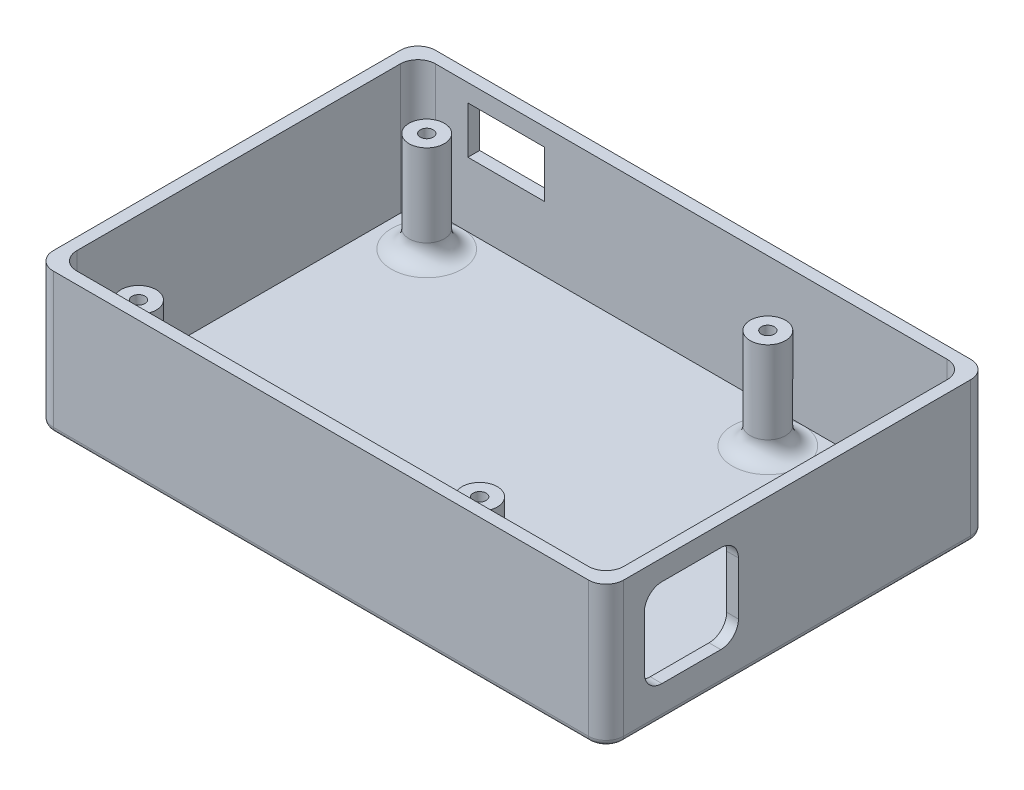
from build123d import *

# Parameters (mm, degrees)
SKETCH1_W           = 97
SKETCH1_H           = 65
BOSS_EXTRUDE1_DEPTH = 2
SKETCH3_W           = 97
SKETCH3_H           = 65
SKETCH3_W_2         = 93
SKETCH3_H_2         = 61
BOSS_EXTRUDE2_DEPTH = 22
SKETCH4_R           = 3
BOSS_EXTRUDE3_DEPTH = 17
SKETCH5_R           = 1.1
CUT_EXTRUDE1_DEPTH  = 10
FILLET1_R           = 3
FILLET2_R           = 3
CUT_EXTRUDE2_REACH  = 107.077
SKETCH6_W           = 16
SKETCH6_H           = 15
FILLET3_R           = 3
CUT_EXTRUDE3_REACH  = 86.577
SKETCH7_W           = 13
SKETCH7_H           = 8
FILLET4_R           = 1


with BuildPart() as part:
    # Sketch1 → Boss-Extrude1 (new body)
    with BuildSketch(Plane(origin=(0, 0, 0), x_dir=(1, 0, 0), z_dir=(0, 1, 0))):
        Rectangle(SKETCH1_W, SKETCH1_H)
    extrude(amount=BOSS_EXTRUDE1_DEPTH)

    # Sketch3 → Boss-Extrude2 (add)
    with BuildSketch(Plane(origin=(0, 2, 0), x_dir=(1, 0, 0), z_dir=(0, 1, 0))):
        Rectangle(SKETCH3_W, SKETCH3_H)
        Rectangle(SKETCH3_W_2, SKETCH3_H_2, mode=Mode.SUBTRACT)
    extrude(amount=BOSS_EXTRUDE2_DEPTH)

    # Sketch4 → Boss-Extrude3 (add)
    with BuildSketch(Plane(origin=(0, 2, 0), x_dir=(1, 0, 0), z_dir=(0, 1, 0))):
        with Locations(Location((-39, 24.5, 0), (0, 0, 270))):
            Circle(SKETCH4_R)
        with Locations(Location((-39, -24.5, 0), (0, 0, 90))):
            Circle(SKETCH4_R)
        with Locations(Location((19, -24.5, 0), (0, 0, 270))):
            Circle(SKETCH4_R)
        with Locations(Location((19, 24.5, 0), (0, 0, 90))):
            Circle(SKETCH4_R)
    extrude(amount=BOSS_EXTRUDE3_DEPTH)

    # Sketch5 → Cut-Extrude1 (cut)
    with BuildSketch(Plane(origin=(0, 19, 0), x_dir=(1, 0, 0), z_dir=(0, 1, 0))):
        with Locations(Location((-39, 24.5, 0), (0, 0, 270))):
            Circle(SKETCH5_R)
        with Locations(Location((19, 24.5, 0), (0, 0, 270))):
            Circle(SKETCH5_R)
        with Locations(Location((19, -24.5, 0), (0, 0, 270))):
            Circle(SKETCH5_R)
        with Locations(Location((-39, -24.5, 0), (0, 0, 270))):
            Circle(SKETCH5_R)
    extrude(amount=-CUT_EXTRUDE1_DEPTH, mode=Mode.SUBTRACT)

    # Fillet1
    fillet1_edges = [part.edges().sort_by_distance(p)[0] for p in [
        (-39, 2, -27.5),
        (-39, 2, 27.5),
        (19, 2, 21.5),
        (19, 2, -21.5),
    ]]
    fillet(fillet1_edges, radius=FILLET1_R - 0.0001)  # a hair under: the kernel refuses the full size

    # Fillet2
    fillet2_edges = [part.edges().sort_by_distance(p)[0] for p in [
        (46.5, 13, -30.5),
        (-46.5, 13, -30.5),
        (-46.5, 13, 30.5),
        (46.5, 13, 30.5),
        (48.5, 12, 32.5),
        (-48.5, 12, 32.5),
        (-48.5, 12, -32.5),
        (48.5, 12, -32.5),
    ]]
    fillet(fillet2_edges, radius=FILLET2_R)

    # Sketch6 → Cut-Extrude2 (cut, up to next)
    with BuildSketch(Plane(origin=(48.5, 0, 0), x_dir=(0, 0, -1), z_dir=(1, 0, 0)), mode=Mode.PRIVATE) as cut_extrude2_sk1:
        with Locations((-18, 13)):
            Rectangle(SKETCH6_W, SKETCH6_H)
    cut_extrude2_tool1 = extrude(cut_extrude2_sk1.sketch, amount=-CUT_EXTRUDE2_REACH, mode=Mode.PRIVATE) & part.part
    add(cut_extrude2_tool1.solids().sort_by_distance((48.5, 13, 18))[0], mode=Mode.SUBTRACT)

    # Fillet3
    fillet3_edges = [part.edges().sort_by_distance(p)[0] for p in [
        (47.5, 20.5, 26),
        (47.5, 5.5, 26),
        (47.5, 5.5, 10),
        (47.5, 20.5, 10),
    ]]
    fillet(fillet3_edges, radius=FILLET3_R)

    # Sketch7 → Cut-Extrude3 (cut, up to next)
    with BuildSketch(Plane(origin=(0, 0, -32.5), x_dir=(-1, 0, 0), z_dir=(0, 0, -1)), mode=Mode.PRIVATE) as cut_extrude3_sk1:
        with Locations((31.5, 17)):
            Rectangle(SKETCH7_W, SKETCH7_H)
    cut_extrude3_tool1 = extrude(cut_extrude3_sk1.sketch, amount=-CUT_EXTRUDE3_REACH, mode=Mode.PRIVATE) & part.part
    add(cut_extrude3_tool1.solids().sort_by_distance((-31.5, 17, -32.5))[0], mode=Mode.SUBTRACT)

    # Fillet4
    fillet4_edges = [part.edges().sort_by_distance(p)[0] for p in [
        (0, 0, -32.5),
        (48.5, 0, 0),
        (0, 0, 32.5),
        (-48.5, 0, 0),
        (-47.621320344, 0, -31.621320344),
        (-47.621320344, 0, 31.621320344),
        (47.621320344, 0, 31.621320344),
        (47.621320344, 0, -31.621320344),
    ]]
    fillet(fillet4_edges, radius=FILLET4_R)


solid = part.part
